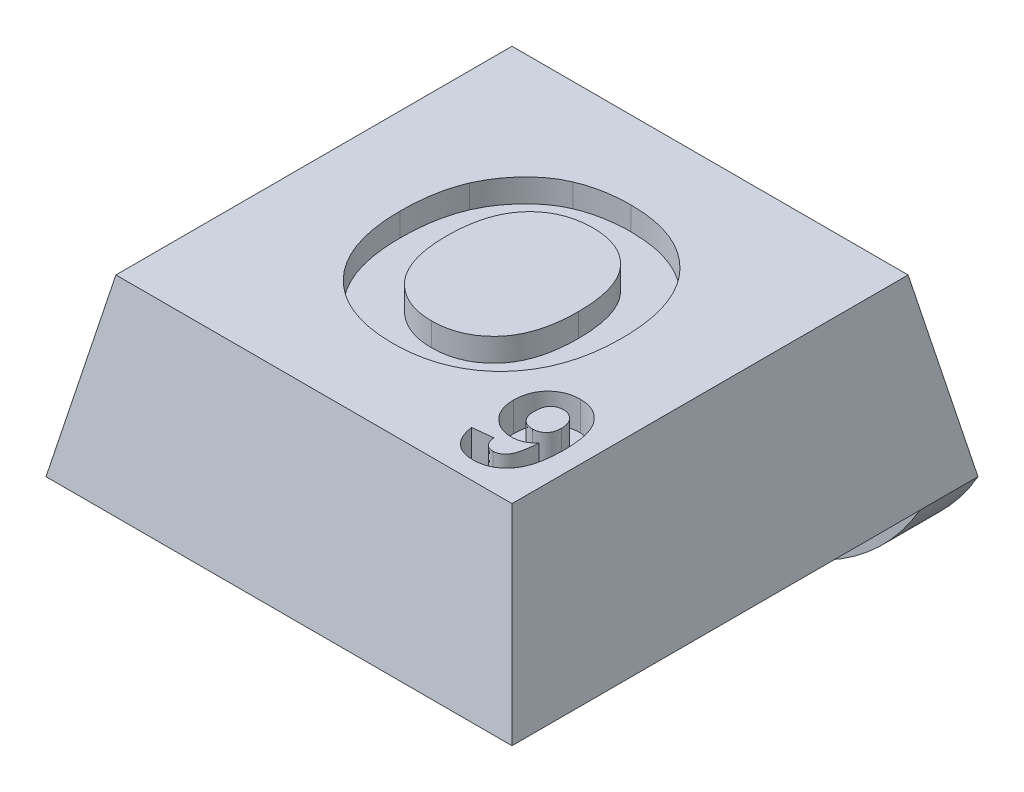
from build123d import *

# Parameters (mm, degrees)
SKETCH1_W               = 8
SKETCH1_H               = 8
BOSS_EXTRUDE1_DEPTH     = 3
CUT_EXTRUDE1_DEPTH      = 12.704699911
CUT_EXTRUDE1_DEPTH_BACK = 12.704699911
CUT_EXTRUDE2_DEPTH      = 11
SKETCH4_R               = 1.75
CUT_EXTRUDE3_DEPTH      = 0.4
SKETCH5_W               = 8
SKETCH5_H               = 1
BOSS_EXTRUDE2_DEPTH     = 2
FILLET1_R               = 4
CUT_EXTRUDE4_DEPTH      = 0.4
CUT_EXTRUDE5_DEPTH      = 0.5


with BuildPart() as part:
    # Sketch1 → Boss-Extrude1 (new body)
    with BuildSketch(Plane(origin=(0, 0, 0), x_dir=(1, 0, 0), z_dir=(0, 1, 0))):
        with Locations((4, 4)):
            Rectangle(SKETCH1_W, SKETCH1_H)
    extrude(amount=BOSS_EXTRUDE1_DEPTH)

    # Sketch2 → Cut-Extrude1 (cut, two sides: drawn at the far end of the back side and taken through both)
    with BuildSketch(Plane.XY.offset(-CUT_EXTRUDE1_DEPTH_BACK)):
        Polygon((0, 0), (0.6, 3), (0, 3), align=None)
        Polygon((8, 0), (7.4, 3), (8, 3), align=None)
    extrude(amount=CUT_EXTRUDE1_DEPTH + CUT_EXTRUDE1_DEPTH_BACK, mode=Mode.SUBTRACT)

    # Sketch3 → Cut-Extrude2 (cut)
    with BuildSketch(Plane(origin=(0, 0, 0), x_dir=(0, 0, -1), z_dir=(1, 0, 0))):
        Polygon((0, 0), (0.6, 3), (0, 3), align=None)
        Polygon((8, 3), (7.4, 3), (8, 0), align=None)
    extrude(amount=CUT_EXTRUDE2_DEPTH, mode=Mode.SUBTRACT)

    # Sketch4 → Cut-Extrude3 (cut)
    with BuildSketch(Plane.XZ):
        with Locations(Location((4, -3.75, 0), (0, 0, 270))):
            Circle(SKETCH4_R)
    extrude(amount=-CUT_EXTRUDE3_DEPTH, mode=Mode.SUBTRACT)

    # Sketch5 → Boss-Extrude2 (add)
    with BuildSketch(Plane.XZ):
        with Locations((4, -7.5)):
            Rectangle(SKETCH5_W, SKETCH5_H)
    extrude(amount=BOSS_EXTRUDE2_DEPTH)

    # Fillet1
    # the kernel refuses this fillet: 4 mm, written as the material it takes off along each edge
    with BuildSketch(Plane(origin=(8, -2, -16.660254038), x_dir=(0, 1, 0), z_dir=(0, 0, 1)), Plane(origin=(0, -2, 1.660254038), x_dir=(0, 1, 0), z_dir=(0, 0, -1))) as fillet1_piece_1:
        with BuildLine():
            CenterArc((4, 3.464101615), FILLET1_R, 180, 60)
            Line((0, 3.464101615), (-0.08, 3.464101615))
            Line((-0.08, 3.464101615), (-0.08, 0))
            Line((-0.08, 0), (0, -0.08))
            ThreePointArc((0, -0.08), (1, -0.08), (1.96, -0.069282032))
            Line((1.96, -0.069282032), (2, 0))
        make_face()
    extrude(amount=18.320508076, mode=Mode.SUBTRACT)

    # Sketch6 → Cut-Extrude4 (cut)
    with BuildSketch(Plane(origin=(0, 3, 0), x_dir=(1, 0, 0), z_dir=(0, 1, 0))):
        with BuildLine():
            add(Edge.make_bspline(
                [(2.089654898, 3.986528763), (2.089937962, 4.035959112), (2.090493863, 4.133033938), (2.100126328, 4.27544635), (2.112822668, 4.411953966), (2.133498637, 4.542019848), (2.157821125, 4.666252751), (2.188242102, 4.784615798), (2.224888607, 4.896693893), (2.254041192, 4.968254545), (2.268340796, 5.003355686)],
                knots=[0, 0, 0, 0, 1.141009212, 2.240794809, 3.294380675, 4.305229195, 5.280013876, 6.216333343, 7.125095522, 8, 8, 8, 8], degree=3))
            add(Edge.make_bspline(
                [(2.268340796, 5.003355686), (2.291715222, 5.053256024), (2.338189152, 5.15246979), (2.424498545, 5.292666818), (2.522325153, 5.424883974), (2.630863596, 5.548428123), (2.747342854, 5.661439376), (2.872312421, 5.758160736), (3.001332505, 5.841858689), (3.093095075, 5.883953785), (3.138533104, 5.904797994)],
                knots=[0, 0, 0, 0, 1.031372299, 2.050613973, 3.077158538, 4.108712802, 5.127684358, 6.111366908, 7.06480644, 8, 8, 8, 8], degree=3))
            add(Edge.make_bspline(
                [(3.138533104, 5.904797994), (3.169376267, 5.917449171), (3.231718165, 5.943020427), (3.328604813, 5.974934694), (3.429167615, 6.000863593), (3.532679205, 6.024041008), (3.640144595, 6.040022598), (3.750695421, 6.053422612), (3.864936689, 6.060445793), (3.94221093, 6.06137636), (3.981481822, 6.061849276)],
                knots=[0, 0, 0, 0, 0.92659354, 1.872881803, 2.832850937, 3.813025581, 4.820167273, 5.851730198, 6.908245912, 8, 8, 8, 8], degree=3))
            add(Edge.make_bspline(
                [(3.981481822, 6.061849276), (4.051799393, 6.060086645), (4.189411847, 6.056637153), (4.390424999, 6.03172188), (4.580644474, 5.989650147), (4.759426374, 5.9288409), (4.928312103, 5.852828021), (5.085989518, 5.7585427), (5.232691986, 5.647005393), (5.368136158, 5.519745635), (5.490113336, 5.376985207), (5.596345325, 5.220057705), (5.685459602, 5.049698506), (5.758850354, 4.866377637), (5.815245616, 4.669496317), (5.855991141, 4.459610063), (5.880197281, 4.23656428), (5.883057671, 4.083544992), (5.884526693, 4.00495825)],
                knots=[0, 0, 0, 0, 1.064641025, 2.083517118, 3.061799897, 4.009540929, 4.938075217, 5.861300345, 6.78508344, 7.723570974, 8.670267188, 9.622657076, 10.586935816, 11.576069104, 12.607749008, 13.683335114, 14.81022093, 16, 16, 16, 16], degree=3))
            add(Edge.make_bspline(
                [(5.884526693, 4.00495825), (5.883091601, 3.926897736), (5.880297745, 3.774928499), (5.855639782, 3.553632965), (5.816583507, 3.345276789), (5.758823703, 3.150335932), (5.687623357, 2.967322864), (5.597592073, 2.798417418), (5.493584902, 2.641379175), (5.37178097, 2.500157102), (5.2386164, 2.372167), (5.092100017, 2.261933284), (4.935570416, 2.167520211), (4.767605484, 2.091287667), (4.589299985, 2.031730764), (4.400072033, 1.989335741), (4.199824576, 1.964516346), (4.062748303, 1.961054329), (3.99269977, 1.959285173)],
                knots=[0, 0, 0, 0, 1.18845052, 2.313691126, 3.386664782, 4.412527756, 5.405809582, 6.372003093, 7.321919452, 8.268293321, 9.206237639, 10.129603466, 11.054616372, 11.9847576, 12.932764752, 13.912672021, 14.933336461, 16, 16, 16, 16], degree=3))
            add(Edge.make_bspline(
                [(3.99269977, 1.959285173), (3.921851099, 1.961058411), (3.783179897, 1.964529147), (3.580796614, 1.989272994), (3.389690252, 2.031681973), (3.209996896, 2.091448367), (3.040491004, 2.166522847), (2.882737558, 2.259971154), (2.736649357, 2.370903), (2.60237212, 2.497386547), (2.480643503, 2.638193424), (2.376784009, 2.794221956), (2.286748029, 2.961477617), (2.215173347, 3.142493932), (2.157731606, 3.335408473), (2.118579893, 3.541331287), (2.09387425, 3.75969562), (2.091087056, 3.909535694), (2.089654898, 3.986528763)],
                knots=[0, 0, 0, 0, 1.080878253, 2.11558926, 3.1052859, 4.062802436, 5.000434901, 5.928596448, 6.853693179, 7.793554778, 8.738606028, 9.68692032, 10.647726704, 11.63151566, 12.651483354, 13.714466703, 14.825613081, 16, 16, 16, 16], degree=3))
        make_face()
        with BuildLine():
            add(Edge.make_bspline(
                [(2.858885668, 4.012971071), (2.85965412, 3.957640503), (2.861142212, 3.850493912), (2.876992368, 3.694973228), (2.901046254, 3.549583199), (2.936421027, 3.414488839), (2.98111032, 3.289592419), (3.035863968, 3.174789463), (3.100455695, 3.069908984), (3.176556171, 2.977165157), (3.258890919, 2.894362796), (3.347763935, 2.822717871), (3.441518937, 2.761052648), (3.541778172, 2.712368162), (3.646455066, 2.673731696), (3.756362885, 2.645084172), (3.872048117, 2.629353868), (3.950988508, 2.627098013), (3.991097206, 2.62595184)],
                knots=[0, 0, 0, 0, 1.313550922, 2.543666373, 3.708465049, 4.810029406, 5.85539231, 6.85404609, 7.825601258, 8.772642133, 9.696587791, 10.59409323, 11.479048685, 12.35559886, 13.234601248, 14.125357077, 15.047515647, 16, 16, 16, 16], degree=3))
            add(Edge.make_bspline(
                [(3.991097206, 2.62595184), (4.031211308, 2.62707479), (4.110162334, 2.629284937), (4.225705423, 2.645336869), (4.335831051, 2.6727565), (4.440092094, 2.711194976), (4.538963761, 2.760652512), (4.632359934, 2.820935331), (4.719742254, 2.892906209), (4.801987382, 2.974505658), (4.876033724, 3.06786548), (4.940075505, 3.17272786), (4.994802176, 3.288227099), (5.039496175, 3.414406406), (5.074000367, 3.551503186), (5.097072556, 3.699589977), (5.113050883, 3.858243352), (5.114532906, 3.967789388), (5.115295924, 4.02418902)],
                knots=[0, 0, 0, 0, 0.949153107, 1.868086493, 2.754172764, 3.630100905, 4.492260106, 5.365378617, 6.254840125, 7.166615376, 8.102436631, 9.067266169, 10.06813181, 11.121736829, 12.23011542, 13.408501285, 14.665770308, 16, 16, 16, 16], degree=3))
            add(Edge.make_bspline(
                [(5.115295924, 4.02418902), (5.114434086, 4.080044083), (5.112765054, 4.18821272), (5.098229512, 4.344863246), (5.07442298, 4.490602534), (5.041329269, 4.625392829), (4.997593851, 4.74925585), (4.945357013, 4.862530314), (4.882195257, 4.964624424), (4.809756461, 5.055485317), (4.729599598, 5.135460421), (4.643086506, 5.205475199), (4.549725647, 5.26373175), (4.45042821, 5.312746734), (4.344160403, 5.349110772), (4.232002157, 5.375634395), (4.113636071, 5.391967682), (4.032549387, 5.394095071), (3.991097206, 5.395182609)],
                knots=[0, 0, 0, 0, 1.332337092, 2.580197383, 3.749299508, 4.852775005, 5.886662144, 6.878700295, 7.822989687, 8.743523536, 9.644687758, 10.519443927, 11.392806431, 12.264866173, 13.155606721, 14.065961015, 15.011303331, 16, 16, 16, 16], degree=3))
            add(Edge.make_bspline(
                [(3.991097206, 5.395182609), (3.949639786, 5.394111799), (3.868542852, 5.392017134), (3.749992261, 5.375413426), (3.637480681, 5.349680139), (3.531227894, 5.311239711), (3.431065544, 5.262695426), (3.337364104, 5.202490837), (3.249385236, 5.13259488), (3.168510191, 5.05140717), (3.094897659, 4.95975062), (3.031705485, 4.856409024), (2.977820274, 4.742511001), (2.933610582, 4.617719403), (2.900837529, 4.481690937), (2.87564871, 4.335339795), (2.861503604, 4.177780175), (2.859777069, 4.069088169), (2.858885668, 4.012971071)],
                knots=[0, 0, 0, 0, 0.981996942, 1.920933313, 2.83127778, 3.712125466, 4.592427284, 5.463259035, 6.34592384, 7.249932058, 8.173122297, 9.125107726, 10.113123258, 11.154048744, 12.256187849, 13.424658091, 14.670364834, 16, 16, 16, 16], degree=3))
        make_face(mode=Mode.SUBTRACT)
    extrude(amount=-CUT_EXTRUDE4_DEPTH, mode=Mode.SUBTRACT)

    # Sketch7 → Cut-Extrude5 (cut)
    with BuildSketch(Plane(origin=(0, 3, 0), x_dir=(1, 0, 0), z_dir=(0, 1, 0))):
        with BuildLine():
            Line((5.919673238, 1.385150086), (6.265827085, 1.42337124))
            add(Edge.make_bspline(
                [(6.265827085, 1.42337124), (6.268093719, 1.406798429), (6.272378124, 1.375472412), (6.286077938, 1.332486308), (6.303248644, 1.295587697), (6.326582557, 1.265894382), (6.354429027, 1.243230056), (6.386321993, 1.226875754), (6.42238873, 1.217455211), (6.447742367, 1.216285786), (6.4608992, 1.215678932)],
                knots=[0, 0, 0, 0, 1.261142327, 2.383817955, 3.394783384, 4.319218401, 5.209639591, 6.086630953, 7.00709008, 8, 8, 8, 8], degree=3))
            add(Edge.make_bspline(
                [(6.4608992, 1.215678932), (6.469463915, 1.215877443), (6.48639024, 1.216269757), (6.511151402, 1.221800705), (6.535112542, 1.229554718), (6.558026685, 1.240903559), (6.579674771, 1.255509372), (6.600593604, 1.273042464), (6.620141529, 1.294064918), (6.639558346, 1.318194878), (6.657133692, 1.347837476), (6.672644926, 1.383790834), (6.687127361, 1.426044982), (6.699023874, 1.475125411), (6.709731865, 1.530609127), (6.719047247, 1.592673694), (6.726604955, 1.661357033), (6.729945358, 1.709414119), (6.731692469, 1.734549125)],
                knots=[0, 0, 0, 0, 0.636702566, 1.258306339, 1.881198412, 2.509855161, 3.155497192, 3.822694, 4.538353708, 5.290656154, 6.125969777, 7.095962945, 8.203044623, 9.449504243, 10.854253673, 12.411741228, 14.12325476, 16, 16, 16, 16], degree=3))
            add(Edge.make_bspline(
                [(6.731692469, 1.734549125), (6.720618656, 1.722663456), (6.698785026, 1.699229134), (6.66262354, 1.668484234), (6.624120879, 1.642635813), (6.583474019, 1.621801075), (6.541107005, 1.604779019), (6.496323285, 1.593582217), (6.449746419, 1.585900099), (6.417902627, 1.585242808), (6.401764585, 1.584909702)],
                knots=[0, 0, 0, 0, 1.041520616, 2.053509057, 3.037255372, 4.009786987, 4.979165048, 5.959157055, 6.965725879, 8, 8, 8, 8], degree=3))
            add(Edge.make_bspline(
                [(6.401764585, 1.584909702), (6.384073531, 1.585417068), (6.349144023, 1.58641882), (6.297757672, 1.59369416), (6.248246766, 1.606100449), (6.20053226, 1.62330461), (6.154855365, 1.646107833), (6.110633648, 1.672992311), (6.068816059, 1.705534296), (6.02879244, 1.741895892), (5.992799641, 1.782831269), (5.960655082, 1.826725194), (5.933454298, 1.873819086), (5.911514497, 1.924062891), (5.894546495, 1.977136799), (5.882210111, 2.032996238), (5.875002086, 2.091932278), (5.874020377, 2.132245686), (5.873519392, 2.152818355)],
                knots=[0, 0, 0, 0, 0.980269742, 1.935460739, 2.869230488, 3.804804075, 4.740187949, 5.694100724, 6.667990488, 7.67211685, 8.68661751, 9.683203946, 10.682901945, 11.694007529, 12.71565541, 13.766145059, 14.860022949, 16, 16, 16, 16], degree=3))
            add(Edge.make_bspline(
                [(5.873519392, 2.152818355), (5.873975276, 2.174237886), (5.874869524, 2.216253842), (5.882714765, 2.277509257), (5.89469614, 2.335819022), (5.91258647, 2.390666415), (5.934848394, 2.442640499), (5.9625181, 2.491089482), (5.994678957, 2.536687239), (6.032260336, 2.578077882), (6.073111954, 2.615966992), (6.117181051, 2.64893897), (6.164211963, 2.676494183), (6.213788023, 2.699393552), (6.266281134, 2.717029421), (6.321355802, 2.729597085), (6.379065584, 2.737389696), (6.418446315, 2.73829424), (6.438543431, 2.738755855)],
                knots=[0, 0, 0, 0, 1.1238417, 2.204496613, 3.236450213, 4.243990082, 5.227299393, 6.199188572, 7.167261658, 8.150145869, 9.127934804, 10.088143708, 11.032722787, 11.984040773, 12.949643861, 13.93368149, 14.945498424, 16, 16, 16, 16], degree=3))
            add(Edge.make_bspline(
                [(6.438543431, 2.738755855), (6.460453106, 2.738150473), (6.503415401, 2.73696339), (6.566381423, 2.727078367), (6.626126126, 2.710260061), (6.683243159, 2.687706994), (6.736909249, 2.657660802), (6.787822577, 2.621397782), (6.835302892, 2.578177603), (6.880181486, 2.528856177), (6.92101348, 2.47186563), (6.955777905, 2.405999335), (6.985348869, 2.331880957), (7.009217525, 2.249351324), (7.027868081, 2.158431597), (7.040740471, 2.059123523), (7.049353916, 1.951407429), (7.050070695, 1.876754909), (7.050442469, 1.838034702)],
                knots=[0, 0, 0, 0, 0.854852685, 1.67626545, 2.479841517, 3.273455256, 4.067207639, 4.874322592, 5.708061326, 6.568303409, 7.473035808, 8.43640186, 9.467839227, 10.582672616, 11.785182758, 13.086903962, 14.489057258, 16, 16, 16, 16], degree=3))
            add(Edge.make_bspline(
                [(7.050442469, 1.838034702), (7.049905126, 1.79871546), (7.048866956, 1.722749047), (7.040490349, 1.613081373), (7.027231708, 1.511820305), (7.007737917, 1.419146767), (6.983274539, 1.334727535), (6.952513245, 1.258884181), (6.916686501, 1.191225552), (6.874746552, 1.132374631), (6.828639372, 1.081226557), (6.77908296, 1.036914907), (6.726006277, 0.999573302), (6.669869922, 0.96842552), (6.609834533, 0.945100242), (6.546730883, 0.928201542), (6.480389219, 0.917254763), (6.43498132, 0.916210596), (6.411860738, 0.915678932)],
                knots=[0, 0, 0, 0, 1.487495966, 2.873904204, 4.158892752, 5.348685137, 6.453750751, 7.479786756, 8.440129076, 9.343583348, 10.206541379, 11.040779453, 11.853317241, 12.65721927, 13.463689683, 14.283322899, 15.125910407, 16, 16, 16, 16], degree=3))
            add(Edge.make_bspline(
                [(6.411860738, 0.915678932), (6.395260473, 0.91602056), (6.362689978, 0.916690848), (6.315004498, 0.922083364), (6.269756957, 0.931453812), (6.22709796, 0.944540129), (6.186694571, 0.960632245), (6.148889811, 0.981047781), (6.113673831, 1.005320091), (6.080446982, 1.032703168), (6.050544064, 1.06444472), (6.023036939, 1.099489729), (5.998361231, 1.138188869), (5.977345666, 1.180874772), (5.957946225, 1.226557184), (5.942319159, 1.276248618), (5.929285874, 1.329388352), (5.922934037, 1.366234586), (5.919673238, 1.385150086)],
                knots=[0, 0, 0, 0, 1.056675019, 2.073245589, 3.050223185, 3.994251036, 4.910773036, 5.814621688, 6.723026041, 7.630269412, 8.550362125, 9.493303905, 10.463425011, 11.466105649, 12.519144845, 13.620215273, 14.778306119, 16, 16, 16, 16], degree=3))
        make_face()
        with BuildLine():
            add(Edge.make_bspline(
                [(6.704288623, 2.144164509), (6.704161126, 2.155596857), (6.703913334, 2.177815627), (6.699699382, 2.209992235), (6.693585254, 2.240123792), (6.685487612, 2.268544564), (6.674181885, 2.29478467), (6.660772094, 2.319257309), (6.644926849, 2.341766242), (6.620534086, 2.368061578), (6.587423021, 2.396365915), (6.543067414, 2.420951263), (6.495426581, 2.436280337), (6.46245481, 2.437923574), (6.445754969, 2.438755855)],
                knots=[0, 0, 0, 0, 0.937516427, 1.822063352, 2.657744432, 3.45986214, 4.242145632, 4.997087526, 5.746986504, 6.494090859, 7.936347984, 9.300605415, 10.632786197, 12, 12, 12, 12], degree=3))
            add(Edge.make_bspline(
                [(6.445754969, 2.438755855), (6.430166677, 2.438049049), (6.399825759, 2.436673327), (6.356401274, 2.424308935), (6.317063151, 2.404241152), (6.288409376, 2.380829385), (6.267989359, 2.358499377), (6.255191006, 2.338496725), (6.244293407, 2.316200896), (6.235271023, 2.291421796), (6.228151789, 2.264145996), (6.22310419, 2.234228027), (6.220356515, 2.201908816), (6.219905587, 2.179506028), (6.219673238, 2.167962586)],
                knots=[0, 0, 0, 0, 1.397188569, 2.719475933, 4.017809812, 5.337496372, 6.01771949, 6.727108146, 7.460709441, 8.242571956, 9.09066939, 9.98839818, 10.963485712, 12, 12, 12, 12], degree=3))
            add(Edge.make_bspline(
                [(6.219673238, 2.167962586), (6.21985919, 2.156174267), (6.220218572, 2.133391395), (6.223589754, 2.100385349), (6.228647094, 2.069760423), (6.236862223, 2.041755733), (6.246514376, 2.015972616), (6.258169977, 1.992332693), (6.272971404, 1.971709233), (6.294352761, 1.947247537), (6.325634684, 1.922347167), (6.368049363, 1.900635228), (6.414905277, 1.887212479), (6.447708858, 1.885689499), (6.464504969, 1.884909702)],
                knots=[0, 0, 0, 0, 1.000122719, 1.932902026, 2.813346472, 3.630219284, 4.405058741, 5.14865055, 5.858963796, 6.55275156, 7.902081098, 9.220520156, 10.576848858, 12, 12, 12, 12], degree=3))
            add(Edge.make_bspline(
                [(6.464504969, 1.884909702), (6.480827547, 1.885549269), (6.512677039, 1.886797228), (6.557990171, 1.900126415), (6.599587786, 1.920571896), (6.630021148, 1.944701937), (6.651777108, 1.967556777), (6.665779678, 1.987183928), (6.677850945, 2.008665471), (6.687490977, 2.032192213), (6.69507263, 2.05755983), (6.700411291, 2.084726876), (6.703726875, 2.113793779), (6.704097261, 2.133818605), (6.704288623, 2.144164509)],
                knots=[0, 0, 0, 0, 1.470045212, 2.868431389, 4.227473852, 5.634383908, 6.348475288, 7.071419378, 7.805118666, 8.569021284, 9.362200428, 10.192314795, 11.06605236, 12, 12, 12, 12], degree=3))
        make_face(mode=Mode.SUBTRACT)
    extrude(amount=-CUT_EXTRUDE5_DEPTH, mode=Mode.SUBTRACT)


solid = part.part
